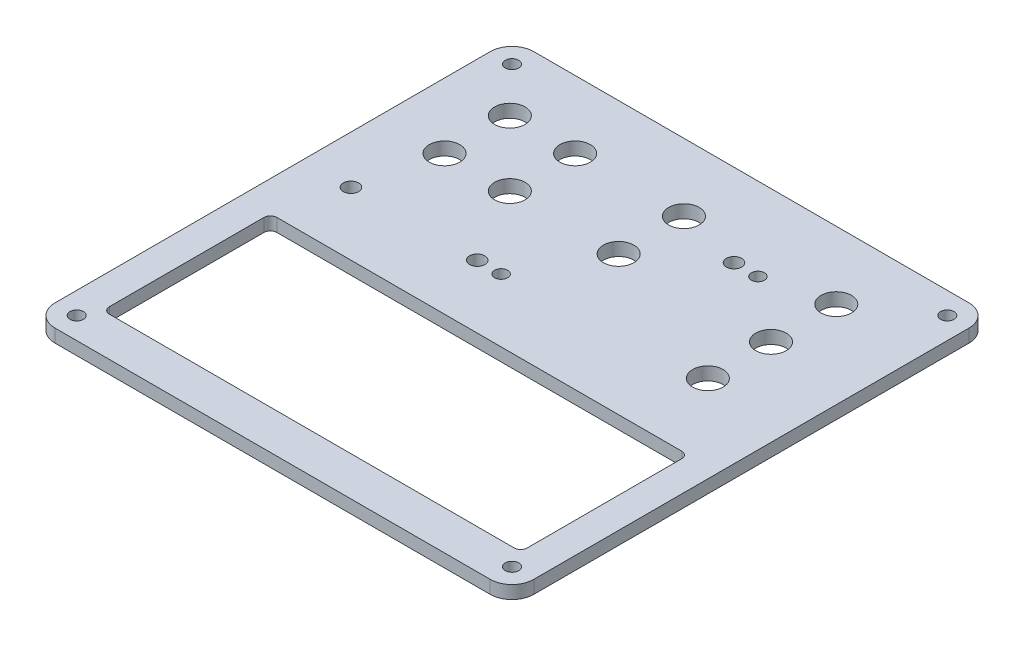
from build123d import *

# Parameters (mm, degrees)
SKETCH1_W           = 110
SKETCH1_H           = 110
SKETCH1_R           = 1.55
BOSS_EXTRUDE1_DEPTH = 3
FILLET1_R           = 5
SKETCH2_W           = 96
SKETCH2_H           = 38.5
CUT_EXTRUDE1_DEPTH  = 78.839578622
FILLET2_R           = 1.5
SKETCH3_R           = 3.5
CUT_EXTRUDE2_DEPTH  = 78.839578622
SKETCH4_R           = 1.75
SKETCH4_R_2         = 1.5
CUT_EXTRUDE3_DEPTH  = 78.839578622


with BuildPart() as part:
    # Sketch1 → Boss-Extrude1 (new body)
    with BuildSketch(Plane(origin=(0, 0, 0), x_dir=(1, 0, 0), z_dir=(0, 1, 0))):
        Rectangle(SKETCH1_W, SKETCH1_H)
        with Locations((-50, 50)):
            Circle(SKETCH1_R, mode=Mode.SUBTRACT)
        with Locations((50, 50)):
            Circle(SKETCH1_R, mode=Mode.SUBTRACT)
        with Locations((50, -50)):
            Circle(SKETCH1_R, mode=Mode.SUBTRACT)
        with Locations((-50, -50)):
            Circle(SKETCH1_R, mode=Mode.SUBTRACT)
    extrude(amount=BOSS_EXTRUDE1_DEPTH)

    # Fillet1
    fillet1_edges = [part.edges().sort_by_distance(p)[0] for p in [
        (-55, 1.5, -55),
        (55, 1.5, -55),
        (55, 1.5, 55),
        (-55, 1.5, 55),
    ]]
    fillet(fillet1_edges, radius=FILLET1_R)

    # Sketch2 → Cut-Extrude1 (cut, through all)
    with BuildSketch(Plane(origin=(0, 3, 0), x_dir=(1, 0, 0), z_dir=(0, 1, 0))):
        with Locations((0, -26.75)):
            Rectangle(SKETCH2_W, SKETCH2_H)
    extrude(amount=-CUT_EXTRUDE1_DEPTH, mode=Mode.SUBTRACT)

    # Fillet2
    fillet2_edges = [part.edges().sort_by_distance(p)[0] for p in [
        (-48, 1.5, 46),
        (48, 1.5, 46),
        (48, 1.5, 7.5),
        (-48, 1.5, 7.5),
    ]]
    fillet(fillet2_edges, radius=FILLET2_R)

    # Sketch3 → Cut-Extrude2 (cut, through all)
    with BuildSketch(Plane(origin=(0, 3, 0), x_dir=(1, 0, 0), z_dir=(0, 1, 0))):
        with Locations((-40, 39.5)):
            Circle(SKETCH3_R)
        with Locations((-40, 24.5)):
            Circle(SKETCH3_R)
        with Locations((-25, 39.5)):
            Circle(SKETCH3_R)
        with Locations((-25, 24.5)):
            Circle(SKETCH3_R)
        with Locations((0, 39.5)):
            Circle(SKETCH3_R)
        with Locations((0, 24.5)):
            Circle(SKETCH3_R)
        with Locations((35, 39.5)):
            Circle(SKETCH3_R)
        with Locations((35, 24.5)):
            Circle(SKETCH3_R)
        with Locations((35, 10)):
            Circle(SKETCH3_R)
    extrude(amount=-CUT_EXTRUDE2_DEPTH, mode=Mode.SUBTRACT)

    # Sketch4 → Cut-Extrude3 (cut, through all)
    with BuildSketch(Plane(origin=(0, 3, 0), x_dir=(1, 0, 0), z_dir=(0, 1, 0))):
        with Locations((-44, 7)):
            Circle(SKETCH4_R)
        with Locations((-15, 7)):
            Circle(SKETCH4_R)
        with Locations((-9.5, 7)):
            Circle(SKETCH4_R_2)
        with Locations((15, 36)):
            Circle(SKETCH4_R)
        with Locations((20.5, 36)):
            Circle(SKETCH4_R_2)
    extrude(amount=-CUT_EXTRUDE3_DEPTH, mode=Mode.SUBTRACT)


solid = part.part
